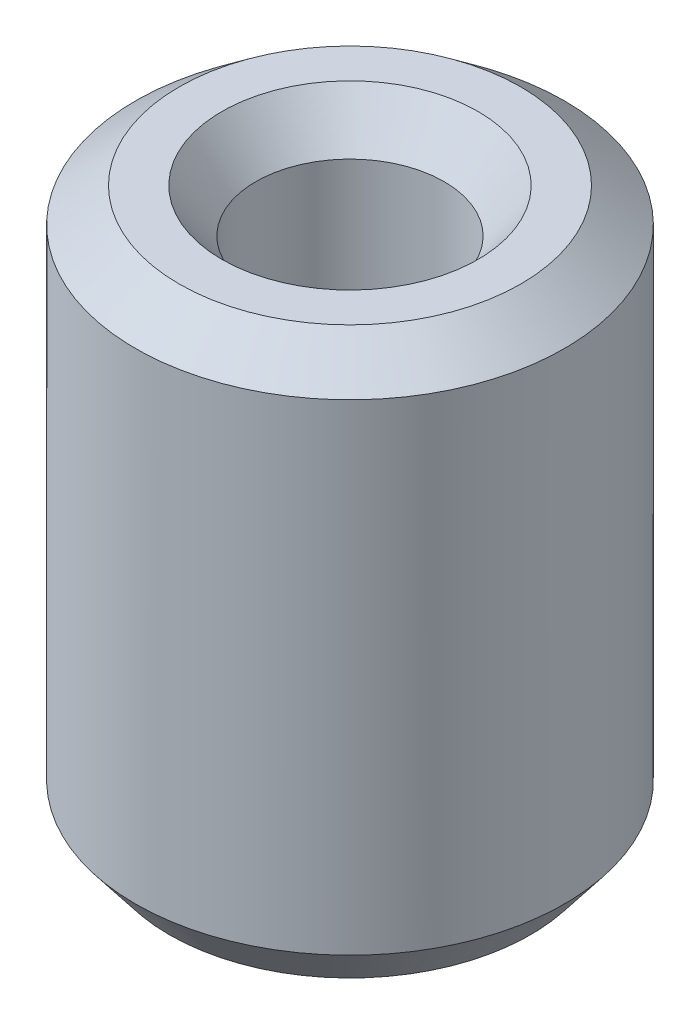
from build123d import *
from OCP.BRepFilletAPI import BRepFilletAPI_MakeChamfer

# Parameters (mm, degrees)
SKETCH1_R           = 20
BOSS_EXTRUDE1_DEPTH = 52.092992751
SKETCH2_R           = 8.779654223
CUT_EXTRUDE1_DEPTH  = 60.276301283
CHAMFER1_SIZE       = 3.166975822
CHAMFER1_SIZE2      = 4.077302141


with BuildPart() as part:
    # Sketch1 → Boss-Extrude1 (new body)
    with BuildSketch(Plane(origin=(0, 0, 0), x_dir=(1, 0, 0), z_dir=(0, 1, 0))):
        Circle(SKETCH1_R)
    extrude(amount=BOSS_EXTRUDE1_DEPTH)

    # Sketch2 → Cut-Extrude1 (cut, through all)
    with BuildSketch(Plane(origin=(0, 0, 0), x_dir=(1, 0, 0), z_dir=(0, 1, 0))):
        Circle(SKETCH2_R)
    extrude(amount=CUT_EXTRUDE1_DEPTH, mode=Mode.SUBTRACT)

    # Chamfer1: one chamfer whose edges measure the first distance from different faces: ONE call of the kernel's chamfer builder (chamfer() names one face for all edges)
    chamfer1_edges_1 = [part.edges().sort_by_distance(p)[0] for p in [
        (-8.779654223, 52.092992751, 0),
    ]]
    chamfer1_side_1 = [part.faces().sort_by_distance(p)[0] for p in [
        (-19.434314575, 52.092992751, 0),
    ]]
    chamfer1_edges_2 = [part.edges().sort_by_distance(p)[0] for p in [
        (-8.779654223, 0, 0),
    ]]
    chamfer1_side_2 = [part.faces().sort_by_distance(p)[0] for p in [
        (-8.779654223, 26.046496376, 0),
    ]]
    chamfer1_edges_3 = [part.edges().sort_by_distance(p)[0] for p in [
        (-20, 0, 0),
    ]]
    chamfer1_side_3 = [part.faces().sort_by_distance(p)[0] for p in [
        (-19.434314575, 0, 0),
    ]]
    chamfer1_edges_4 = [part.edges().sort_by_distance(p)[0] for p in [
        (-20, 52.092992751, 0),
    ]]
    chamfer1_side_4 = [part.faces().sort_by_distance(p)[0] for p in [
        (-20, 26.046496376, 0),
    ]]
    chamfer1 = BRepFilletAPI_MakeChamfer(part.part.solid().wrapped)
    for e in chamfer1_edges_1:
        chamfer1.Add(CHAMFER1_SIZE, CHAMFER1_SIZE2, e.wrapped, chamfer1_side_1[0].wrapped)  # the first distance lies on this face
    for e in chamfer1_edges_2:
        chamfer1.Add(CHAMFER1_SIZE, CHAMFER1_SIZE2, e.wrapped, chamfer1_side_2[0].wrapped)  # the first distance lies on this face
    for e in chamfer1_edges_3:
        chamfer1.Add(CHAMFER1_SIZE, CHAMFER1_SIZE2, e.wrapped, chamfer1_side_3[0].wrapped)  # the first distance lies on this face
    for e in chamfer1_edges_4:
        chamfer1.Add(CHAMFER1_SIZE, CHAMFER1_SIZE2, e.wrapped, chamfer1_side_4[0].wrapped)  # the first distance lies on this face
    add(Compound.cast(chamfer1.Shape()), mode=Mode.REPLACE)


solid = part.part
